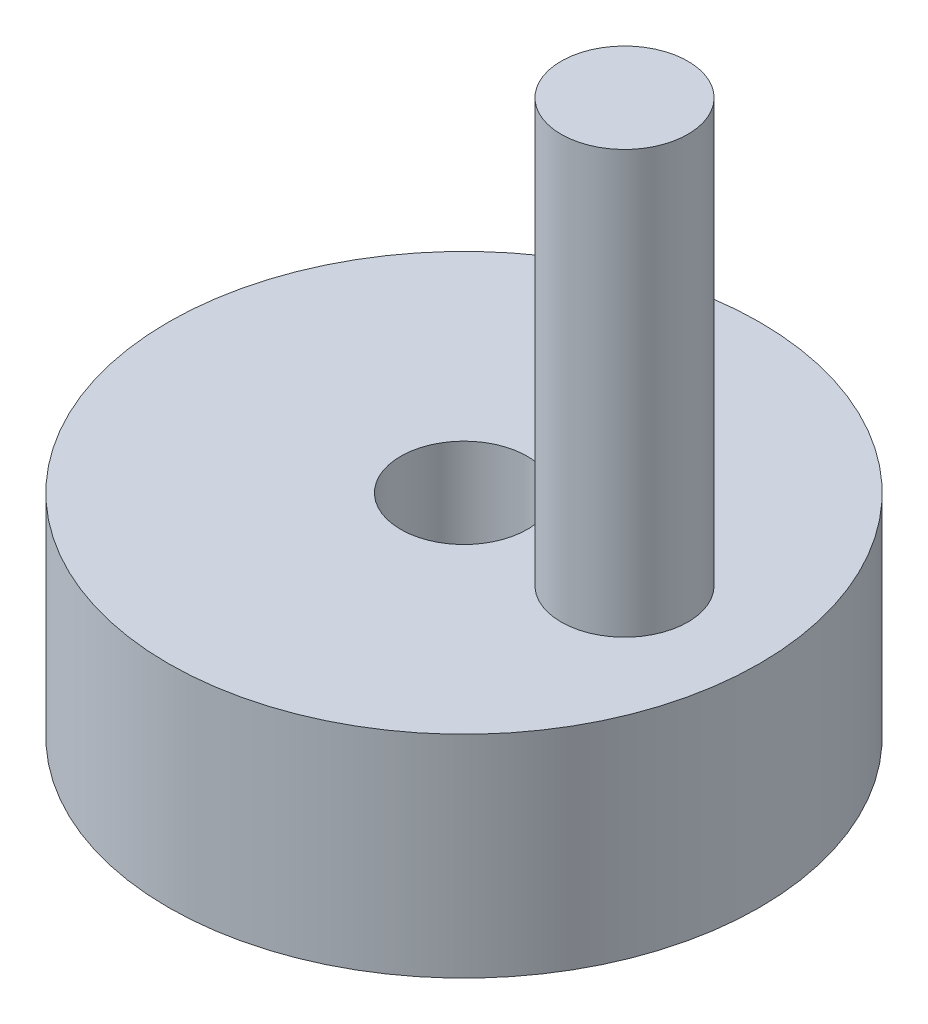
from build123d import *

# Parameters (mm, degrees)
SKETCH1_R           = 70
SKETCH1_R_2         = 15
BOSS_EXTRUDE1_DEPTH = 50
SKETCH2_R           = 15
BOSS_EXTRUDE2_DEPTH = 100


with BuildPart() as part:
    # Sketch1 → Boss-Extrude1 (new body)
    with BuildSketch(Plane(origin=(0, 0, 0), x_dir=(1, 0, 0), z_dir=(0, 1, 0))):
        Circle(SKETCH1_R)
        Circle(SKETCH1_R_2, mode=Mode.SUBTRACT)
    extrude(amount=BOSS_EXTRUDE1_DEPTH)

    # Sketch2 → Boss-Extrude2 (add)
    with BuildSketch(Plane(origin=(0, 50, 0), x_dir=(1, 0, 0), z_dir=(0, 1, 0))):
        with Locations((38, 0)):
            Circle(SKETCH2_R)
    extrude(amount=BOSS_EXTRUDE2_DEPTH)


solid = part.part
